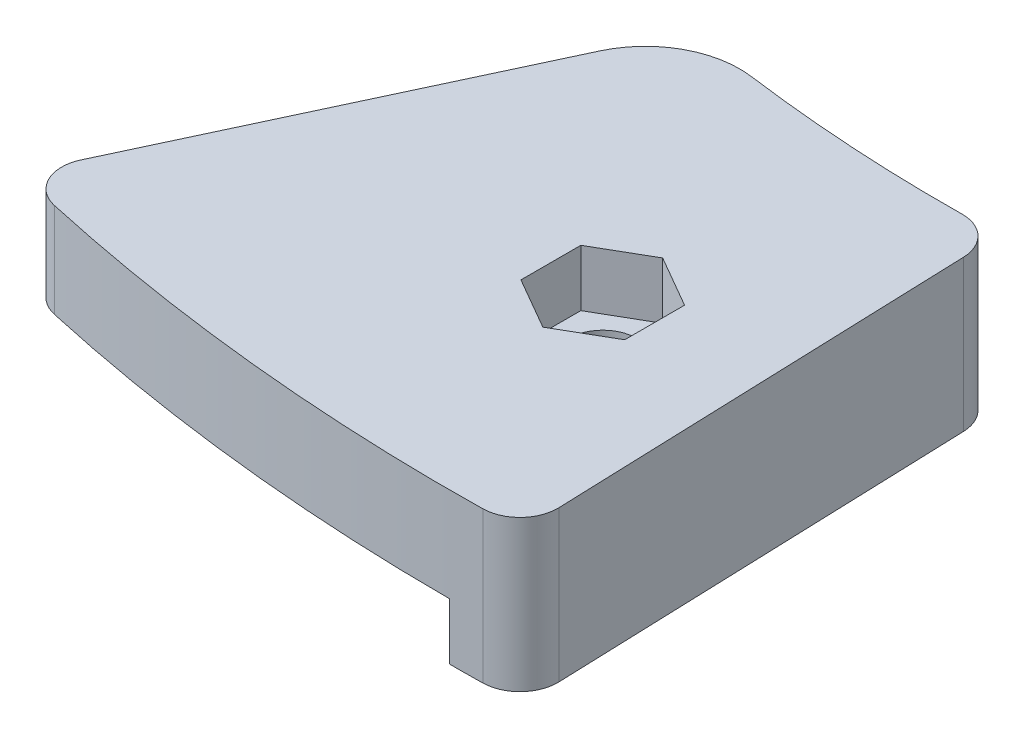
from build123d import *

# Parameters (mm, degrees)
RESSALTO_EXTRUS_O4_DEPTH = 5
ESBO_O8_R                = 1.8
CORTE_EXTRUS_O3_DEPTH    = 112.673524207
RESSALTO_EXTRUS_O5_START = -8
RESSALTO_EXTRUS_O5_DEPTH = 8
CORTE_EXTRUS_O4_DEPTH    = 3
FILETE1_R                = 5
FILETE2_R                = 2


with BuildPart() as part:
    # Esboço6 → Ressalto-extrusão4 (new body)
    with BuildSketch(Plane(origin=(0, 0, 0), x_dir=(1, 0, 0), z_dir=(0, 1, 0))):
        with BuildLine():
            Line((0, -82.26), (0, -108.5))
            ThreePointArc((0, -108.5), (-13.073364664, -107.709503464), (-25.956232563, -105.349532468))
            Line((-25.956232563, -105.349532468), (-14.581921132, -80.957242888))
            ThreePointArc((-14.581921132, -80.957242888), (-7.32, -81.933663411), (0, -82.26))
        make_face()
    extrude(amount=RESSALTO_EXTRUS_O4_DEPTH)

    # Esboço8 → Corte-extrusão3 (cut, through all)
    with BuildSketch(Plane(origin=(0, 5, 0), x_dir=(1, 0, 0), z_dir=(0, 1, 0))):
        with Locations(Location((-5, -95.38, 0), (0, 0, 270))):
            Circle(ESBO_O8_R)
    extrude(amount=-CORTE_EXTRUS_O3_DEPTH, mode=Mode.SUBTRACT)

    # Esboço7 → Ressalto-extrusão5 (add)
    with BuildSketch(Plane(origin=(0, 5, 0), x_dir=(1, 0, 0), z_dir=(0, 1, 0)).offset(RESSALTO_EXTRUS_O5_START)):
        with BuildLine():
            ThreePointArc((0, -108.5), (1.893586098, -108.483474924), (3.786595392, -108.433904732))
            Line((3.786595392, -108.433904732), (2.870832599, -82.209889431))
            ThreePointArc((2.870832599, -82.209889431), (1.435634954, -82.247471404), (0, -82.26))
            Line((0, -82.26), (0, -108.5))
        make_face()
    extrude(amount=RESSALTO_EXTRUS_O5_DEPTH)

    # Esboço9 → Corte-extrusão4 (cut)
    with BuildSketch(Plane(origin=(0, 5, 0), x_dir=(1, 0, 0), z_dir=(0, 1, 0))):
        Polygon((-7.75, -93.79228676), (-7.75, -96.96771324), (-5, -98.555426481), (-2.25, -96.96771324), (-2.25, -93.79228676), (-5, -92.204573519), align=None)
    extrude(amount=-CORTE_EXTRUS_O4_DEPTH, mode=Mode.SUBTRACT)

    # Filete1
    filete1_edges = [part.edges().sort_by_distance(p)[0] for p in [
        (-14.581921132, 2.5, 80.957242888),
    ]]
    fillet(filete1_edges, radius=FILETE1_R)

    # Filete2
    # the kernel refuses this fillet: 2 mm, written as the material it takes off along each edge
    with BuildSketch(Plane(origin=(-25.956232563, -6.211327666, 105.349532468), x_dir=(0.42261826174069944, 0, -0.9063077870366499), z_dir=(0, 1, 0))) as filete2_piece_1:
        with BuildLine():
            CenterArc((2.461525654, -2), FILETE2_R, 90, 102.471061381)
            ThreePointArc((0.508715252, -2.431892969), (0.247396438, -1.21740266), (0, 0))
            Line((0, 0), (2.461525654, 0))
        make_face()
    extrude(amount=17.422655332, mode=Mode.SUBTRACT)
    with BuildSketch(Plane(origin=(2.870832599, -7.940651502, 82.209889431), x_dir=(-0.9997346498502194, 0, 0.023035405116018468), z_dir=(0, 1, 0))) as filete2_piece_2:
        with BuildLine():
            CenterArc((1.976403158, 1.999859125), FILETE2_R, 180.680051756, 88.639896488)
            Line((-0.023455967, 1.976121398), (0, 0))
            ThreePointArc((0, 0), (0.976332715, 0.005794184), (1.952665431, 0))
        make_face()
    extrude(amount=17.881303004, mode=Mode.SUBTRACT)
    with BuildSketch(Plane(origin=(3.786595392, -8.094121302, 108.433904732), x_dir=(-0.034899496702502156, 0, -0.9993908270190958), z_dir=(0, 1, 0))) as filete2_piece_3:
        with BuildLine():
            CenterArc((2.018780999, 2), FILETE2_R, 178.923959667, 91.076040333)
            ThreePointArc((0.019133694, 2.037558685), (0.004783529, 1.01882426), (0, 0))
            Line((0, 0), (2.018780999, 0))
        make_face()
    extrude(amount=18.188242605, mode=Mode.SUBTRACT)
    with BuildSketch(Plane(origin=(0, -7.940651502, 82.26), x_dir=(0.9999295625583442, 0, -0.011868863546203106), z_dir=(0, 1, 0))) as filete2_piece_4:
        with BuildLine():
            CenterArc((1.976403158, -1.999859125), FILETE2_R, 90.680051756, 88.639896488)
            Line((-0.023455967, -1.976121398), (0, 0))
            ThreePointArc((0, 0), (0.976332715, -0.005794184), (1.952665431, 0))
        make_face()
    extrude(amount=7.940651502, mode=Mode.SUBTRACT)


solid = part.part
